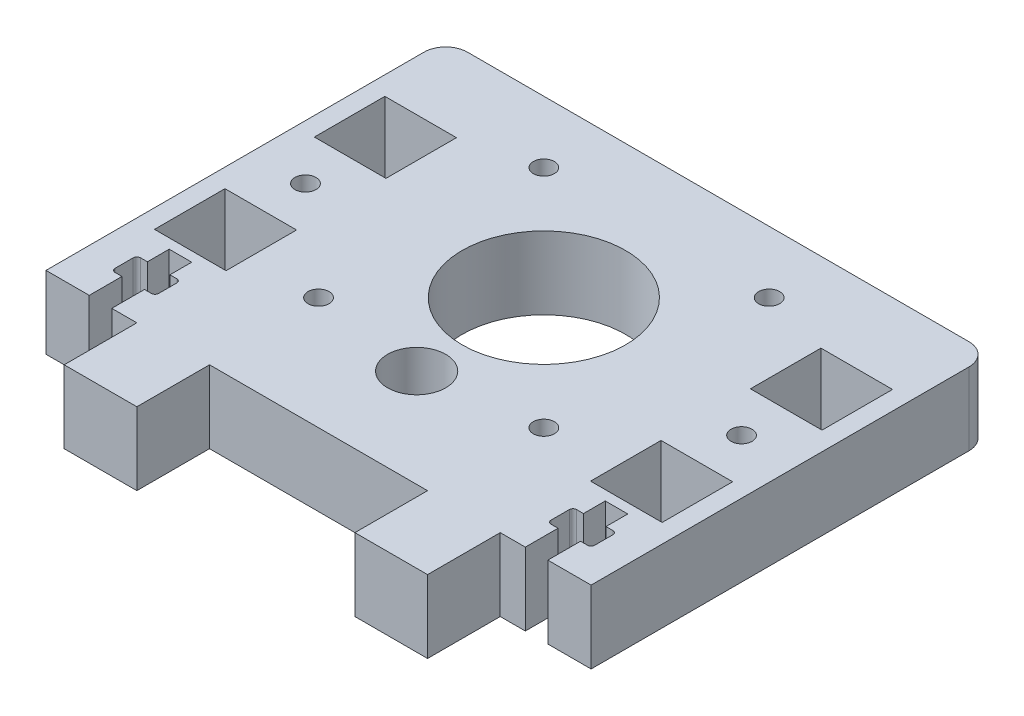
from build123d import *

# Parameters (mm, degrees)
SKETCH1_R        = 1.45
SKETCH1_W        = 9.85
SKETCH1_H        = 9.7
MAINLAYOUT_DEPTH = 10
TSLOT_DEPTH      = 53.936282454


with BuildPart() as part:
    # Sketch1 → MainLayout (new body)
    with BuildSketch(Plane(origin=(0, 0, 0), x_dir=(1, 0, 0), z_dir=(0, 1, 0))):
        with BuildLine():
            Line((-34.5, 29), (0, 29))
            Line((0, 29), (0, 16.25))
            ThreePointArc((0, 16.25), (-11.25, 5), (0, -6.25))
            Line((0, -6.25), (0, -8.5))
            ThreePointArc((0, -8.5), (-4, -12.5), (0, -16.5))
            Line((0, -16.5), (0, -26))
            Line((0, -26), (-15, -26))
            Line((-15, -26), (-15, -36))
            Line((-15, -36), (-25, -36))
            Line((-25, -36), (-25, -26))
            Line((-25, -26), (-37.5, -26))
            Line((-37.5, -26), (-37.5, 26))
            ThreePointArc((-37.5, 26), (-36.621320344, 28.121320344), (-34.5, 29))
        make_face()
        with Locations((-15.5, 20.5)):
            Circle(SKETCH1_R, mode=Mode.SUBTRACT)
        with Locations((-15.5, -10.5)):
            Circle(SKETCH1_R, mode=Mode.SUBTRACT)
        with Locations((-30, 2.2)):
            Circle(SKETCH1_R, mode=Mode.SUBTRACT)
        with Locations((-30, 13.2)):
            Rectangle(SKETCH1_W, SKETCH1_H, mode=Mode.SUBTRACT)
        with Locations((-30, -8.8)):
            Rectangle(SKETCH1_W, SKETCH1_H, mode=Mode.SUBTRACT)
    mainlayout = extrude(amount=MAINLAYOUT_DEPTH)

    # Sketch2 → TSlot (cut, through all)
    with BuildSketch(Plane(origin=(0, 10, 0), x_dir=(1, 0, 0), z_dir=(0, 1, 0))):
        with BuildLine():
            Line((-28.45, -21.5), (-28.45, -26))
            Line((-28.45, -26), (-31.55, -26))
            Line((-31.55, -26), (-31.55, -21.5))
            Line((-31.55, -21.5), (-32.5, -21.5))
            ThreePointArc((-32.5, -21.5), (-32.853553391, -21.353553391), (-33, -21))
            Line((-33, -21), (-33, -18.5))
            ThreePointArc((-33, -18.5), (-32.853553391, -18.146446609), (-32.5, -18))
            Line((-32.5, -18), (-31.55, -18))
            Line((-31.55, -18), (-31.55, -15))
            Line((-31.55, -15), (-28.45, -15))
            Line((-28.45, -15), (-28.45, -18))
            Line((-28.45, -18), (-27.5, -18))
            ThreePointArc((-27.5, -18), (-27.146446609, -18.146446609), (-27, -18.5))
            Line((-27, -18.5), (-27, -21))
            ThreePointArc((-27, -21), (-27.146446609, -21.353553391), (-27.5, -21.5))
            Line((-27.5, -21.5), (-28.45, -21.5))
        make_face()
    tslot = extrude(amount=-TSLOT_DEPTH, mode=Mode.SUBTRACT)

    # Mirror1: MainLayout, TSlot across plane
    add(mainlayout.mirror(Plane(origin=(0, 0, 0), x_dir=(0, 0, 1), z_dir=(1, 0, 0))))
    add(tslot.mirror(Plane(origin=(0, 0, 0), x_dir=(0, 0, 1), z_dir=(1, 0, 0))), mode=Mode.SUBTRACT)


solid = part.part
